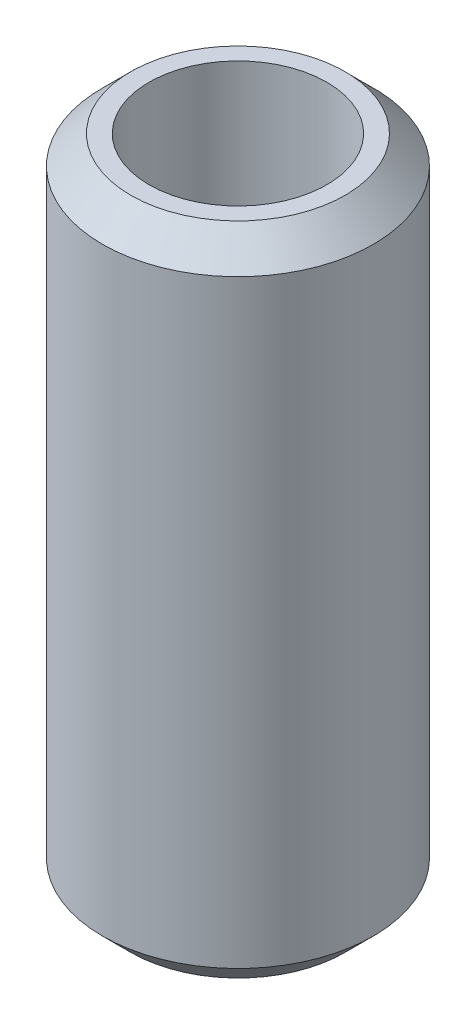
from build123d import *

# Parameters (mm, degrees)
SKETCH1_R           = 22.5
BOSS_EXTRUDE1_DEPTH = 108.923869523
SKETCH2_R           = 14.765011188
CUT_EXTRUDE1_DEPTH  = 114.476470477
CHAMFER1_SIZE       = 4.700245858


with BuildPart() as part:
    # Sketch1 → Boss-Extrude1 (new body)
    with BuildSketch(Plane(origin=(0, 0, 0), x_dir=(1, 0, 0), z_dir=(0, 1, 0))):
        Circle(SKETCH1_R)
    extrude(amount=BOSS_EXTRUDE1_DEPTH)

    # Sketch2 → Cut-Extrude1 (cut, through all)
    with BuildSketch(Plane(origin=(0, 0, 0), x_dir=(1, 0, 0), z_dir=(0, 1, 0))):
        Circle(SKETCH2_R)
    extrude(amount=CUT_EXTRUDE1_DEPTH, mode=Mode.SUBTRACT)

    # Chamfer1
    chamfer1_edges = [part.edges().sort_by_distance(p)[0] for p in [
        (-22.5, 108.923869523, 0),
        (-22.5, 0, 0),
    ]]
    chamfer(chamfer1_edges, length=CHAMFER1_SIZE)


solid = part.part
